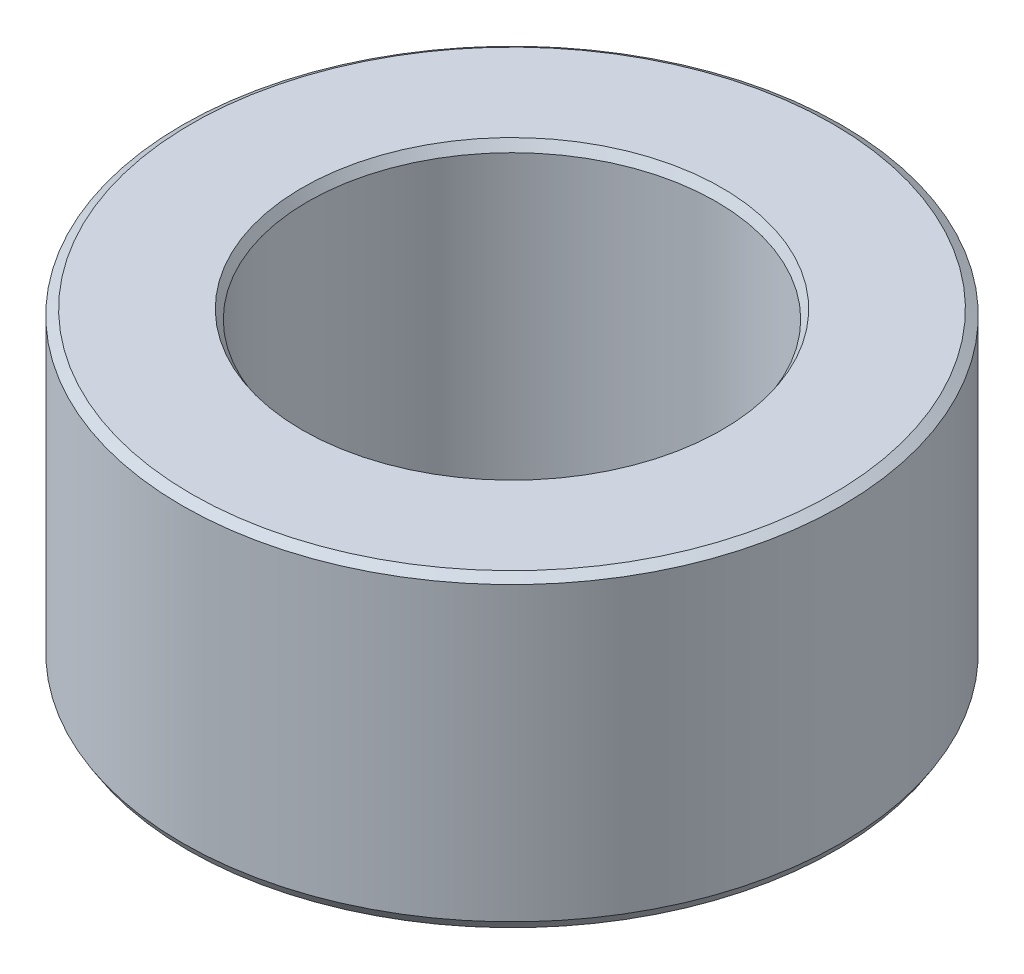
from build123d import *
from OCP.BRepFilletAPI import BRepFilletAPI_MakeChamfer

# Parameters (mm, degrees)
SKETCH1_R           = 50
BOSS_EXTRUDE1_DEPTH = 46.525063639
SKETCH2_R           = 30.962336762
CUT_EXTRUDE1_DEPTH  = 85.643851204
CHAMFER1_SIZE       = 0.858680934
CHAMFER1_SIZE2      = 1.378680265


with BuildPart() as part:
    # Sketch1 → Boss-Extrude1 (new body)
    with BuildSketch(Plane(origin=(0, 0, 0), x_dir=(1, 0, 0), z_dir=(0, 1, 0))):
        Circle(SKETCH1_R)
    extrude(amount=BOSS_EXTRUDE1_DEPTH)

    # Sketch2 → Cut-Extrude1 (cut, through all)
    with BuildSketch(Plane(origin=(0, 0, 0), x_dir=(1, 0, 0), z_dir=(0, 1, 0))):
        Circle(SKETCH2_R)
    extrude(amount=CUT_EXTRUDE1_DEPTH, mode=Mode.SUBTRACT)

    # Chamfer1: one chamfer whose edges measure the first distance from different faces: ONE call of the kernel's chamfer builder (chamfer() names one face for all edges)
    chamfer1_edges_1 = [part.edges().sort_by_distance(p)[0] for p in [
        (-30.962336762, 46.525063639, 0),
    ]]
    chamfer1_side_1 = [part.faces().sort_by_distance(p)[0] for p in [
        (-48.585786438, 46.525063639, 0),
    ]]
    chamfer1_edges_2 = [part.edges().sort_by_distance(p)[0] for p in [
        (-30.962336762, 0, 0),
    ]]
    chamfer1_side_2 = [part.faces().sort_by_distance(p)[0] for p in [
        (-30.962336762, 23.262531819, 0),
    ]]
    chamfer1_edges_3 = [part.edges().sort_by_distance(p)[0] for p in [
        (-50, 0, 0),
    ]]
    chamfer1_side_3 = [part.faces().sort_by_distance(p)[0] for p in [
        (-48.585786438, 0, 0),
    ]]
    chamfer1_edges_4 = [part.edges().sort_by_distance(p)[0] for p in [
        (-50, 46.525063639, 0),
    ]]
    chamfer1_side_4 = [part.faces().sort_by_distance(p)[0] for p in [
        (-50, 23.262531819, 0),
    ]]
    chamfer1 = BRepFilletAPI_MakeChamfer(part.part.solid().wrapped)
    for e in chamfer1_edges_1:
        chamfer1.Add(CHAMFER1_SIZE, CHAMFER1_SIZE2, e.wrapped, chamfer1_side_1[0].wrapped)  # the first distance lies on this face
    for e in chamfer1_edges_2:
        chamfer1.Add(CHAMFER1_SIZE, CHAMFER1_SIZE2, e.wrapped, chamfer1_side_2[0].wrapped)  # the first distance lies on this face
    for e in chamfer1_edges_3:
        chamfer1.Add(CHAMFER1_SIZE, CHAMFER1_SIZE2, e.wrapped, chamfer1_side_3[0].wrapped)  # the first distance lies on this face
    for e in chamfer1_edges_4:
        chamfer1.Add(CHAMFER1_SIZE, CHAMFER1_SIZE2, e.wrapped, chamfer1_side_4[0].wrapped)  # the first distance lies on this face
    add(Compound.cast(chamfer1.Shape()), mode=Mode.REPLACE)


solid = part.part
